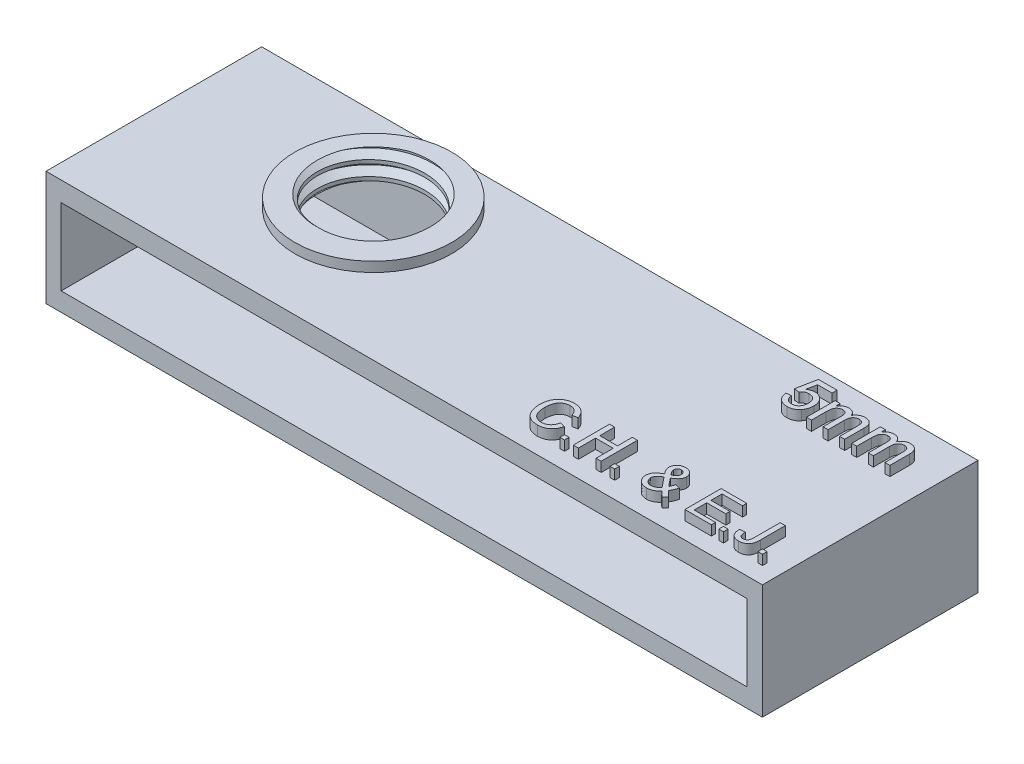
from build123d import *

# Parameters (mm, degrees)
SKIZZE1_W                       = 73.1
SKIZZE1_H                       = 22
BASIS_DEPTH                     = 11.7
SKIZZE2_W                       = 70
SKIZZE2_H                       = 7.8
HANDYSCHLITZ_DEPTH              = 21.25
SKIZZE3_R                       = 6.3
ZYLINDER_DEPTH                  = 1
SKIZZE6_R                       = 8
AUFSATZ_LINEAR_AUSTRAGEN1_DEPTH = 1
SKIZZE8_R                       = 6.3
SCHNITT_LINEAR_AUSTRAGEN2_DEPTH = 6
GEWINDE2_PITCH                  = 1.5
SKIZZE12_R                      = 7.5
SCHNITT_LINEAR_AUSTRAGEN5_DEPTH = 6
SKIZZE17_W                      = 30.300932881
SKIZZE17_H                      = 16.269400137
SCHNITT_LINEAR_AUSTRAGEN7_DEPTH = 6
EAH_JENA_DEPTH                  = 1
LOGO_DEPTH                      = 1
SKIZZE26_W                      = 0.474358974
SKIZZE26_H                      = 0.474358974
SKIZZE26_W_2                    = 0.474358975
C_H_E_J_DEPTH                   = 1
F_5MM_DEPTH                     = 1


with BuildPart() as part:
    # Skizze1 → Basis (new body)
    with BuildSketch(Plane(origin=(0, 0, 0), x_dir=(1, 0, 0), z_dir=(0, 1, 0))):
        with Locations((-9.866464149, 7.203333333)):
            Rectangle(SKIZZE1_W, SKIZZE1_H)
    extrude(amount=BASIS_DEPTH)

    # Skizze2 → Handyschlitz (cut)
    with BuildSketch(Plane.XY.offset(3.796666667)):
        with Locations((-9.866464149, 5.8)):
            Rectangle(SKIZZE2_W, SKIZZE2_H)
    extrude(amount=-HANDYSCHLITZ_DEPTH, mode=Mode.SUBTRACT)

    # Skizze3 → Zylinder (add)
    with BuildSketch(Plane(origin=(0, 11.7, 0), x_dir=(1, 0, 0), z_dir=(0, 1, 0))):
        with Locations(Location((-26.416464149, 9.603333333, 0), (0, 0, 270))):
            Circle(SKIZZE3_R)
    extrude(amount=ZYLINDER_DEPTH)

    # Skizze6 → Aufsatz-Linear austragen1 (add)
    with BuildSketch(Plane(origin=(0, 11.7, 0), x_dir=(1, 0, 0), z_dir=(0, 1, 0))):
        with Locations(Location((-26.416464149, 9.603333333, 0), (0, 0, 270))):
            Circle(SKIZZE6_R)
    extrude(amount=AUFSATZ_LINEAR_AUSTRAGEN1_DEPTH)

    # Skizze8 → Schnitt-Linear austragen2 (cut)
    with BuildSketch(Plane(origin=(0, 12.7, 0), x_dir=(1, 0, 0), z_dir=(0, 1, 0))):
        with Locations(Location((-26.416464149, 9.603333333, 0), (0, 0, 270))):
            Circle(SKIZZE8_R)
    extrude(amount=-SCHNITT_LINEAR_AUSTRAGEN2_DEPTH, mode=Mode.SUBTRACT)

    # Gewinde2: the profile of Gewindeprofil2 profile screwed along a right-hand helix of 5.333333 turns, 8 arcs to a turn; built about Z, then put on its axis
    gewinde2_z = Axis((0, 0, 0), (0, 0, 1))
    gewinde2_corners = [(6.3003, 0, -0.000173205), (6.3003, 0, 1.312673201), (5.488101187, 0, 0.843749998), (5.488101187, 0, 0.468749998)]
    with BuildLine(mode=Mode.PRIVATE) as gewinde2_profile:
        Line(gewinde2_corners[0], gewinde2_corners[1])
        Line(gewinde2_corners[1], gewinde2_corners[2])
        Line(gewinde2_corners[2], gewinde2_corners[3])
        Line(gewinde2_corners[3], gewinde2_corners[0])
    gewinde2_cap = Face(gewinde2_profile.wire())
    gewinde2_turn_angles = [0, 22.5, 45, 67.5, 90, 112.5, 135, 157.5, 180, 202.5, 225, 247.5, 270, 292.5, 315, 337.5, 360]
    gewinde2_turn_weights = [1, 0.9238795325112867, 1, 0.9238795325112867, 1, 0.9238795325112867, 1, 0.9238795325112867, 1, 0.9238795325112867, 1, 0.9238795325112867, 1, 0.9238795325112867, 1, 0.9238795325112867, 1]
    gewinde2_turn_rails = [Edge.make_bspline([Vector(p[0], p[1], 0).rotate(gewinde2_z, gewinde2_turn_angles[k]) / gewinde2_turn_weights[k] + Vector(0, 0, p[2] + GEWINDE2_PITCH * gewinde2_turn_angles[k] / 360) for k in range(17)], [0, 0, 0, 1, 1, 2, 2, 3, 3, 4, 4, 5, 5, 6, 6, 7, 7, 8, 8, 8], 2, gewinde2_turn_weights) for p in gewinde2_corners]
    gewinde2_turn_sides = [Face.make_surface_from_curves(gewinde2_turn_rails[p[0]], gewinde2_turn_rails[p[1]]) for p in [(0, 1), (1, 2), (2, 3), (3, 0)]]
    gewinde2_last_angles = [1800, 1822.5, 1845, 1867.5, 1890, 1905, 1920]
    gewinde2_last_weights = [1, 0.9238795325112867, 1, 0.9238795325112867, 1, 0.9659258262890688, 1]
    gewinde2_last_rails = [Edge.make_bspline([Vector(p[0], p[1], 0).rotate(gewinde2_z, gewinde2_last_angles[k]) / gewinde2_last_weights[k] + Vector(0, 0, p[2] + GEWINDE2_PITCH * gewinde2_last_angles[k] / 360) for k in range(7)], [0, 0, 0, 1, 1, 2, 2, 3, 3, 3], 2, gewinde2_last_weights) for p in gewinde2_corners]
    gewinde2_last_sides = [Face.make_surface_from_curves(gewinde2_last_rails[p[0]], gewinde2_last_rails[p[1]]) for p in [(0, 1), (1, 2), (2, 3), (3, 0)]]
    gewinde2 = Plane(origin=(-26.416464149, 14.3, -9.603333333), x_dir=(-1, 0, 0), z_dir=(0, -1, 0)) * Solid(Shell([*[p.moved(Location((0, 0, GEWINDE2_PITCH * i))) for i in range(5) for p in gewinde2_turn_sides], *gewinde2_last_sides, gewinde2_cap, gewinde2_cap.rotate(gewinde2_z, 1920).moved(Location((0, 0, GEWINDE2_PITCH * 1920 / 360)))]))
    add(gewinde2)

    # Skizze12 → Schnitt-Linear austragen5 (cut)
    with BuildSketch(Plane(origin=(0, 12.7, 0), x_dir=(1, 0, 0), z_dir=(0, 1, 0))):
        with Locations((-26.416464149, 9.603333333)):
            Circle(SKIZZE12_R)
    extrude(amount=SCHNITT_LINEAR_AUSTRAGEN5_DEPTH, mode=Mode.SUBTRACT)

    # Skizze17 → Schnitt-Linear austragen7 (cut)
    with BuildSketch(Plane(origin=(0, 9.7, 0), x_dir=(-1, 0, 0), z_dir=(0, -1, 0))):
        with Locations((28.531838804, 8.134700069)):
            Rectangle(SKIZZE17_W, SKIZZE17_H)
    extrude(amount=SCHNITT_LINEAR_AUSTRAGEN7_DEPTH, mode=Mode.SUBTRACT)

    # Skizze25 → EAH Jena (add)
    # profile 1 of 7: a face of its own
    with BuildSketch(Plane(origin=(0, 0, 0), x_dir=(-1, 0, 0), z_dir=(0, -1, 0))):
        Polygon((6.791710178, -1.663041856), (6.791710178, 1.836958144), (9.259658895, 1.836958144), (9.259658895, 1.43311199), (7.285299921, 1.43311199), (7.285299921, 0.356188913), (9.125043511, 0.356188913), (9.125043511, -0.047657241), (7.285299921, -0.047657241), (7.285299921, -1.259195702), (9.349402485, -1.259195702), (9.349402485, -1.663041856), align=None)
    # profile 2 of 7: a face of its own
    with BuildSketch(Plane(origin=(0, 0, 0), x_dir=(-1, 0, 0), z_dir=(0, -1, 0))):
        Polygon((9.543613222, -1.663041856), (10.93323662, 1.836958144), (11.489927325, 1.836958144), (12.879550722, -1.663041856), (12.355812742, -1.663041856), (11.957575562, -0.586118779), (10.465588383, -0.586118779), (10.067351203, -1.663041856), align=None)
        with BuildLine():
            Line((10.614226203, -0.182272625), (11.808937742, -0.182272625))
            Line((11.808937742, -0.182272625), (11.468893671, 0.737599169))
            add(Edge.make_bspline(
                [(11.468893671, 0.737599169), (11.455857596, 0.773141762), (11.430369606, 0.842634241), (11.392359336, 0.943600948), (11.357633765, 1.039483076), (11.323582491, 1.128905814), (11.292843798, 1.213168117), (11.264511156, 1.291700831), (11.236490413, 1.363958117), (11.219674771, 1.410643768), (11.211581972, 1.43311199)],
                knots=[0, 0, 0, 0, 1.225184869, 2.395467751, 3.491410812, 4.525364584, 5.492066482, 6.394148129, 7.227157926, 8, 8, 8, 8], degree=3))
            add(Edge.make_bspline(
                [(11.211581972, 1.43311199), (11.198194921, 1.377707334), (11.171365621, 1.266669571), (11.115191597, 1.103984353), (11.050930465, 0.942786964), (10.998742768, 0.838912467), (10.97249944, 0.786677695)],
                knots=[0, 0, 0, 0, 0.9891762, 1.982431084, 2.985436691, 4, 4, 4, 4], degree=3))
            Line((10.97249944, 0.786677695), (10.614226203, -0.182272625))
        make_face(mode=Mode.SUBTRACT)
    # profile 3 of 7: a face of its own
    with BuildSketch(Plane(origin=(0, 0, 0), x_dir=(-1, 0, 0), z_dir=(0, -1, 0))):
        Polygon((13.253248639, -1.663041856), (13.253248639, 1.836958144), (13.746838383, 1.836958144), (13.746838383, 0.401060708), (15.451966588, 0.401060708), (15.451966588, 1.836958144), (15.945556331, 1.836958144), (15.945556331, -1.663041856), (15.451966588, -1.663041856), (15.451966588, -0.002785446), (13.746838383, -0.002785446), (13.746838383, -1.663041856), align=None)
    # profile 4 of 7: a face of its own
    with BuildSketch(Plane(origin=(0, 0, 0), x_dir=(-1, 0, 0), z_dir=(0, -1, 0))):
        with BuildLine():
            Line((17.830171716, -0.686379196), (18.32376146, -0.630990574))
            add(Edge.make_bspline(
                [(18.32376146, -0.630990574), (18.325095054, -0.662092888), (18.327646186, -0.721590801), (18.336104163, -0.807008212), (18.347911279, -0.884697448), (18.36253253, -0.954942231), (18.379565969, -1.017791317), (18.400937234, -1.072737648), (18.423953924, -1.120935667), (18.452253265, -1.16088606), (18.482595025, -1.195029748), (18.515973611, -1.224020964), (18.55195843, -1.248725405), (18.590477759, -1.269133188), (18.631964985, -1.28478687), (18.67598885, -1.295660465), (18.722912253, -1.30318799), (18.755153505, -1.303768279), (18.771778286, -1.304067497)],
                knots=[0, 0, 0, 0, 1.632619403, 3.123158228, 4.499702462, 5.75227728, 6.885496867, 7.90993266, 8.841891104, 9.678429245, 10.468404694, 11.232957398, 11.991194639, 12.753385178, 13.513799276, 14.310593147, 15.128879333, 16, 16, 16, 16], degree=3))
            add(Edge.make_bspline(
                [(18.771778286, -1.304067497), (18.795948594, -1.303258637), (18.843177355, -1.301678124), (18.910921454, -1.28543416), (18.974042611, -1.261062533), (19.030755547, -1.22547634), (19.081319043, -1.182174894), (19.124329594, -1.131076481), (19.157092165, -1.072023015), (19.177726711, -1.017500544), (19.190384105, -0.968972917), (19.198667701, -0.926815945), (19.205651202, -0.879785295), (19.210925971, -0.827586205), (19.216281114, -0.770370123), (19.218420462, -0.70788694), (19.220914052, -0.64059173), (19.221100747, -0.594067985), (19.221197357, -0.569992978)],
                knots=[0, 0, 0, 0, 1.177507829, 2.300849353, 3.381033894, 4.466744326, 5.550475886, 6.619462111, 7.707386998, 8.830091395, 9.455333453, 10.153234525, 10.925888378, 11.774835866, 12.713513529, 13.729654905, 14.82514671, 16, 16, 16, 16], degree=3))
            Line((19.221197357, -0.569992978), (19.221197357, 1.836958144))
            Line((19.221197357, 1.836958144), (19.714787101, 1.836958144))
            Line((19.714787101, 1.836958144), (19.714787101, -0.538442497))
            add(Edge.make_bspline(
                [(19.714787101, -0.538442497), (19.714585465, -0.573971391), (19.714195247, -0.64272918), (19.709274699, -0.742842863), (19.70071679, -0.83682133), (19.689966548, -0.924870761), (19.675220284, -1.006805068), (19.656977905, -1.082350925), (19.636304717, -1.152121748), (19.603857092, -1.235394111), (19.554453955, -1.329868022), (19.478858362, -1.430064774), (19.387489561, -1.515539903), (19.281383393, -1.585889093), (19.163086158, -1.640180619), (19.034637285, -1.679598823), (18.896333766, -1.703992263), (18.800627436, -1.706582551), (18.751445754, -1.707913651)],
                knots=[0, 0, 0, 0, 0.979376435, 1.895351937, 2.762129694, 3.580429744, 4.339931879, 5.055623694, 5.722093767, 6.344240595, 7.517202841, 8.648554164, 9.788057829, 10.949533591, 12.142879013, 13.363546981, 14.645176409, 16, 16, 16, 16], degree=3))
            add(Edge.make_bspline(
                [(18.751445754, -1.707913651), (18.714948055, -1.707116316), (18.643854654, -1.705563197), (18.540496883, -1.693216986), (18.443373338, -1.674648981), (18.353691663, -1.644782191), (18.269632392, -1.609837507), (18.192822629, -1.564925889), (18.121947614, -1.513107367), (18.058801793, -1.452160372), (18.0018615, -1.384064763), (17.954778148, -1.306698621), (17.913168703, -1.222861112), (17.88175556, -1.130217094), (17.855988431, -1.03048475), (17.840050493, -0.922391611), (17.82958188, -0.80694885), (17.829971513, -0.727303214), (17.830171716, -0.686379196)],
                knots=[0, 0, 0, 0, 1.110149412, 2.162445788, 3.163771351, 4.112774839, 5.033433762, 5.928696445, 6.813333667, 7.698542325, 8.592646346, 9.506220098, 10.44759987, 11.434914499, 12.476633792, 13.577933972, 14.755478919, 16, 16, 16, 16], degree=3))
        make_face()
    # profile 5 of 7: a face of its own
    with BuildSketch(Plane(origin=(0, 0, 0), x_dir=(-1, 0, 0), z_dir=(0, -1, 0))):
        Polygon((20.522479408, -1.663041856), (20.522479408, 1.836958144), (22.990428126, 1.836958144), (22.990428126, 1.43311199), (21.016069152, 1.43311199), (21.016069152, 0.356188913), (22.855812742, 0.356188913), (22.855812742, -0.047657241), (21.016069152, -0.047657241), (21.016069152, -1.259195702), (23.080171716, -1.259195702), (23.080171716, -1.663041856), align=None)
    # profile 6 of 7: a face of its own
    with BuildSketch(Plane(origin=(0, 0, 0), x_dir=(-1, 0, 0), z_dir=(0, -1, 0))):
        Polygon((23.753248639, -1.663041856), (23.753248639, 1.836958144), (24.274883254, 1.836958144), (25.951966588, -0.774720542), (25.951966588, 1.836958144), (26.445556331, 1.836958144), (26.445556331, -1.663041856), (25.923921716, -1.663041856), (24.246838383, 0.94863683), (24.246838383, -1.663041856), align=None)
    # profile 7 of 7: a face of its own
    with BuildSketch(Plane(origin=(0, 0, 0), x_dir=(-1, 0, 0), z_dir=(0, -1, 0))):
        Polygon((26.774382453, -1.663041856), (28.164005851, 1.836958144), (28.720696556, 1.836958144), (30.110319953, -1.663041856), (29.586581972, -1.663041856), (29.188344793, -0.586118779), (27.696357613, -0.586118779), (27.298120434, -1.663041856), align=None)
        with BuildLine():
            Line((27.844995434, -0.182272625), (29.039706972, -0.182272625))
            Line((29.039706972, -0.182272625), (28.699662902, 0.737599169))
            add(Edge.make_bspline(
                [(28.699662902, 0.737599169), (28.686626826, 0.773141762), (28.661138837, 0.842634241), (28.623128566, 0.943600948), (28.588402995, 1.039483076), (28.554351722, 1.128905814), (28.523613028, 1.213168117), (28.495280387, 1.291700831), (28.467259644, 1.363958117), (28.450444002, 1.410643768), (28.442351203, 1.43311199)],
                knots=[0, 0, 0, 0, 1.225184869, 2.395467751, 3.491410812, 4.525364584, 5.492066482, 6.394148129, 7.227157926, 8, 8, 8, 8], degree=3))
            add(Edge.make_bspline(
                [(28.442351203, 1.43311199), (28.428964152, 1.377707334), (28.402134851, 1.266669571), (28.345960828, 1.103984353), (28.281699695, 0.942786964), (28.229511999, 0.838912467), (28.203268671, 0.786677695)],
                knots=[0, 0, 0, 0, 0.9891762, 1.982431084, 2.985436691, 4, 4, 4, 4], degree=3))
            Line((28.203268671, 0.786677695), (27.844995434, -0.182272625))
        make_face(mode=Mode.SUBTRACT)
    extrude(amount=EAH_JENA_DEPTH)

    # Skizze24 → LOGO (add)
    with BuildSketch(Plane(origin=(0, 0, 0), x_dir=(-1, 0, 0), z_dir=(0, -1, 0))):
        Polygon((33.761487263, 1.43405578), (32.029436456, -1.56594422), (35.493538071, -1.56594422), align=None)
        Polygon((35.947767039, -1.538115831), (37.679817846, 1.461884169), (34.215716231, 1.461884169), align=None)
        Polygon((38.093112145, 1.43405578), (36.361061337, -1.56594422), (39.825162952, -1.56594422), align=None)
        Polygon((40.238164925, -1.538115831), (41.970215732, 1.461884169), (38.506114117, 1.461884169), align=None)
        Polygon((42.342197995, 1.43405578), (40.610147188, -1.56594422), (44.074248803, -1.56594422), align=None)
        Polygon((35.947458768, 4.854602398), (34.21540796, 1.854602398), (37.679509575, 1.854602398), align=None)
        Polygon((38.133781063, 1.93405578), (39.865831871, 4.93405578), (36.401730256, 4.93405578), align=None)
        Polygon((40.279078334, 4.854602398), (38.547027526, 1.854602398), (42.011129142, 1.854602398), align=None)
        Polygon((38.133781063, 8.331557422), (36.401730256, 5.331557422), (39.865831871, 5.331557422), align=None)
    extrude(amount=LOGO_DEPTH)

    # Skizze26 → C.H. & E.J. (add)
    # profile 1 of 9: a face of its own
    with BuildSketch(Plane(origin=(0, 11.7, 0), x_dir=(1, 0, 0), z_dir=(0, 1, 0))):
        with BuildLine():
            Line((3.075711078, -0.786637436), (3.59750595, -0.908191923))
            add(Edge.make_bspline(
                [(3.59750595, -0.908191923), (3.584433532, -0.957098307), (3.55886226, -1.052765264), (3.508304748, -1.189675268), (3.451560142, -1.318159468), (3.38725156, -1.437879412), (3.31467515, -1.548146786), (3.235753894, -1.650378737), (3.147361833, -1.742431365), (3.052742176, -1.826429196), (2.951158207, -1.90051506), (2.843834679, -1.964489562), (2.731290373, -2.018918877), (2.613070418, -2.063678204), (2.489098172, -2.097363435), (2.36001197, -2.121915204), (2.225435405, -2.137037665), (2.133703404, -2.139028581), (2.086969091, -2.140042885)],
                knots=[0, 0, 0, 0, 1.145254194, 2.240259345, 3.299159039, 4.322497661, 5.312016644, 6.284080175, 7.241264552, 8.196044782, 9.144516039, 10.082428046, 11.020306713, 11.970622414, 12.939253955, 13.924100776, 14.94240044, 16, 16, 16, 16], degree=3))
            add(Edge.make_bspline(
                [(2.086969091, -2.140042885), (2.039018781, -2.139346253), (1.94520783, -2.137983348), (1.807780197, -2.126897844), (1.677073022, -2.107671761), (1.553330399, -2.080959872), (1.436135826, -2.04793228), (1.325975275, -2.006380644), (1.223041698, -1.956604773), (1.126476491, -1.899996744), (1.036689799, -1.835687473), (0.951639842, -1.765412494), (0.87339135, -1.687237213), (0.799987815, -1.603007422), (0.733027992, -1.511612013), (0.670048416, -1.41429263), (0.614123082, -1.309334511), (0.563179441, -1.198683581), (0.518465118, -1.083411141), (0.478908583, -0.965794139), (0.446568953, -0.84559821), (0.418726619, -0.723834783), (0.398500512, -0.599479303), (0.382441609, -0.473464815), (0.373612101, -0.345018742), (0.372450231, -0.25867823), (0.371864925, -0.215183109)],
                knots=[0, 0, 0, 0, 1.180702053, 2.309949215, 3.392367133, 4.431746864, 5.425408375, 6.388154007, 7.326956194, 8.237882283, 9.141054626, 10.043899035, 10.951650021, 11.86168169, 12.792564695, 13.739356664, 14.713891418, 15.718426911, 16.737522708, 17.757217648, 18.772674716, 19.801476837, 20.831699174, 21.873853055, 22.928926693, 24, 24, 24, 24], degree=3))
            add(Edge.make_bspline(
                [(0.371864925, -0.215183109), (0.372702036, -0.168228372), (0.374355958, -0.075457672), (0.383692318, 0.06142819), (0.400839828, 0.193539792), (0.424652732, 0.320964035), (0.454785582, 0.443804115), (0.491981207, 0.562119878), (0.535769084, 0.67575994), (0.58601572, 0.784849613), (0.643054943, 0.888171168), (0.705184366, 0.985871486), (0.773886016, 1.076346369), (0.847122989, 1.161324367), (0.926724428, 1.239390499), (1.012447266, 1.310721605), (1.103551922, 1.375968313), (1.200025099, 1.4345249), (1.30060578, 1.485905242), (1.403800018, 1.53167016), (1.51001826, 1.569180732), (1.618418379, 1.600369264), (1.729233749, 1.625198232), (1.842723303, 1.641801441), (1.958782175, 1.652621379), (2.03703813, 1.65408774), (2.076592489, 1.65482891)],
                knots=[0, 0, 0, 0, 1.185634383, 2.342514083, 3.462112933, 4.547331452, 5.613960142, 6.653690668, 7.676612054, 8.686959706, 9.683658101, 10.654407272, 11.607580201, 12.5494388, 13.484601218, 14.419076806, 15.362504069, 16.311442244, 17.265594461, 18.212500624, 19.159571152, 20.107257795, 21.059246075, 22.024387127, 23.001429356, 24, 24, 24, 24], degree=3))
            add(Edge.make_bspline(
                [(2.076592489, 1.65482891), (2.120848487, 1.653994707), (2.207838034, 1.652354997), (2.335479696, 1.638868059), (2.457727082, 1.616278916), (2.575109911, 1.586644097), (2.686407776, 1.54606786), (2.792829008, 1.497827378), (2.893314927, 1.439872282), (2.988647398, 1.373795284), (3.077274555, 1.299474522), (3.160436641, 1.218685498), (3.234742743, 1.129409076), (3.303135834, 1.033805905), (3.36346404, 0.930550295), (3.417946775, 0.820542524), (3.464800341, 0.70296481), (3.489869332, 0.62106868), (3.502634155, 0.579368173)],
                knots=[0, 0, 0, 0, 1.098391872, 2.158997981, 3.181470371, 4.182549255, 5.160268219, 6.118029851, 7.079534476, 8.035645336, 8.993622929, 9.94770573, 10.909620999, 11.872786677, 12.862530088, 13.874594564, 14.917769567, 16, 16, 16, 16], degree=3))
            Line((3.502634155, 0.579368173), (2.980839284, 0.467449103))
            add(Edge.make_bspline(
                [(2.980839284, 0.467449103), (2.970592047, 0.499452101), (2.950535034, 0.56209187), (2.914921845, 0.651364674), (2.876460789, 0.734239002), (2.834235691, 0.810151514), (2.78815504, 0.879120391), (2.739279953, 0.941983849), (2.68643943, 0.997568531), (2.630708291, 1.047156082), (2.570647397, 1.08939993), (2.507664833, 1.126834931), (2.440432615, 1.157806686), (2.369917927, 1.184002392), (2.295461675, 1.203940147), (2.217367056, 1.217967145), (2.135565453, 1.226085283), (2.079822255, 1.22729093), (2.051392168, 1.227905833)],
                knots=[0, 0, 0, 0, 1.235697765, 2.418642872, 3.532555292, 4.594392283, 5.610119701, 6.580908344, 7.519430642, 8.427315627, 9.319973334, 10.216139639, 11.118687699, 12.038725643, 12.980015607, 13.949697744, 14.954307006, 16, 16, 16, 16], degree=3))
            add(Edge.make_bspline(
                [(2.051392168, 1.227905833), (2.018751827, 1.227432254), (1.95455791, 1.226500864), (1.860249322, 1.216306904), (1.769680276, 1.201292196), (1.68352578, 1.17877635), (1.601314389, 1.150704945), (1.523533962, 1.115751079), (1.449522862, 1.074781048), (1.380107091, 1.027548822), (1.315870027, 0.97445071), (1.255068461, 0.918317697), (1.200621543, 0.856531869), (1.150453049, 0.791130549), (1.106023883, 0.720958047), (1.066030191, 0.646970199), (1.030726903, 0.568560616), (0.992243921, 0.458205066), (0.953005363, 0.316069671), (0.918965866, 0.142142015), (0.897283509, -0.034525858), (0.894870255, -0.15335589), (0.893659796, -0.212959551)],
                knots=[0, 0, 0, 0, 0.935256702, 1.839373932, 2.716087708, 3.564631604, 4.388828665, 5.203538865, 6.005592122, 6.810952829, 7.606223804, 8.392839071, 9.180346482, 9.963639178, 10.753404291, 11.558266631, 12.372976832, 13.215232055, 14.905983541, 16.594894834, 18.292041732, 20, 20, 20, 20], degree=3))
            add(Edge.make_bspline(
                [(0.893659796, -0.212959551), (0.895025022, -0.287901181), (0.897673682, -0.433294729), (0.923809451, -0.643993995), (0.963657015, -0.840519697), (1.011747284, -0.993848902), (1.059986656, -1.106947411), (1.099000236, -1.186151928), (1.143532681, -1.259443945), (1.192476307, -1.327239697), (1.246461559, -1.389341426), (1.304736313, -1.44607902), (1.367313587, -1.497998429), (1.434934863, -1.542669211), (1.504997313, -1.58233297), (1.576616805, -1.617602742), (1.649838432, -1.647432354), (1.724957612, -1.670604603), (1.800919471, -1.690628647), (1.87856065, -1.703709293), (1.95785901, -1.711091597), (2.011105897, -1.712438317), (2.038050822, -1.713119808)],
                knots=[0, 0, 0, 0, 2.10686522, 4.087509323, 5.961373225, 7.741398778, 8.594514555, 9.418024779, 10.222433421, 11.003575649, 11.767087398, 12.533660211, 13.289033706, 14.050297079, 14.809623433, 15.552362432, 16.294320901, 17.0305302, 17.761969017, 18.502233515, 19.242073914, 20, 20, 20, 20], degree=3))
            add(Edge.make_bspline(
                [(2.038050822, -1.713119808), (2.0702059, -1.712445448), (2.133723549, -1.711113349), (2.226848488, -1.699453415), (2.316619645, -1.682270975), (2.401949456, -1.655756737), (2.483985702, -1.623293158), (2.562056238, -1.583259887), (2.635915543, -1.535111548), (2.706432365, -1.480443631), (2.772306313, -1.418240883), (2.832676244, -1.34900444), (2.886834893, -1.272418663), (2.93705359, -1.189712643), (2.979246525, -1.098415644), (3.018327145, -1.001248829), (3.050891941, -0.896615174), (3.067319189, -0.823823297), (3.075711078, -0.786637436)],
                knots=[0, 0, 0, 0, 1.013374089, 2.001772144, 2.95501459, 3.891367103, 4.814208647, 5.733921849, 6.652182523, 7.590185968, 8.54346024, 9.504121027, 10.481158517, 11.497760682, 12.549996529, 13.647863555, 14.798406869, 16, 16, 16, 16], degree=3))
        make_face()
    # profile 2 of 9: a face of its own
    with BuildSketch(Plane(origin=(0, 11.7, 0), x_dir=(1, 0, 0), z_dir=(0, 1, 0))):
        with Locations((4.546223899, -1.8554275)):
            Rectangle(SKIZZE26_W, SKIZZE26_H)
    # profile 3 of 9: a face of its own
    with BuildSketch(Plane(origin=(0, 11.7, 0), x_dir=(1, 0, 0), z_dir=(0, 1, 0))):
        Polygon((5.684685437, -2.092606987), (5.684685437, 1.607393013), (6.206480309, 1.607393013), (6.206480309, 0.089444295), (8.009044412, 0.089444295), (8.009044412, 1.607393013), (8.530839284, 1.607393013), (8.530839284, -2.092606987), (8.009044412, -2.092606987), (8.009044412, -0.337478782), (6.206480309, -0.337478782), (6.206480309, -2.092606987), align=None)
    # profile 4 of 9: a face of its own
    with BuildSketch(Plane(origin=(0, 11.7, 0), x_dir=(1, 0, 0), z_dir=(0, 1, 0))):
        with Locations((9.669300822, -1.8554275)):
            Rectangle(SKIZZE26_W, SKIZZE26_H)
    # profile 5 of 9: a face of its own
    with BuildSketch(Plane(origin=(0, 11.7, 0), x_dir=(1, 0, 0), z_dir=(0, 1, 0))):
        with BuildLine():
            add(Edge.make_bspline(
                [(14.274288803, -1.623436314), (14.236749524, -1.664462929), (14.163257436, -1.744782311), (14.042552731, -1.849998573), (13.917470321, -1.940290358), (13.786477409, -2.013029645), (13.65060685, -2.070196079), (13.509204053, -2.110053588), (13.362562531, -2.135543554), (13.262675527, -2.138531887), (13.212169412, -2.140042885)],
                knots=[0, 0, 0, 0, 1.093164284, 2.140129739, 3.143504165, 4.122525029, 5.081066102, 6.036361366, 7.007120508, 8, 8, 8, 8], degree=3))
            add(Edge.make_bspline(
                [(13.212169412, -2.140042885), (13.165909178, -2.138970887), (13.075747117, -2.136881543), (12.944142423, -2.118648824), (12.820070528, -2.088999846), (12.70258584, -2.048568671), (12.593263009, -1.994563428), (12.490632385, -1.929585812), (12.395281166, -1.852701131), (12.339129135, -1.792870963), (12.31088736, -1.762779263)],
                knots=[0, 0, 0, 0, 1.100470892, 2.144838377, 3.154486211, 4.132569556, 5.094958372, 6.049140531, 7.018811397, 8, 8, 8, 8], degree=3))
            add(Edge.make_bspline(
                [(12.31088736, -1.762779263), (12.289477049, -1.736907866), (12.247436665, -1.68610788), (12.19217435, -1.605403866), (12.145441194, -1.522609076), (12.107263764, -1.437246516), (12.077347802, -1.349730381), (12.056934742, -1.259754654), (12.043696914, -1.167750925), (12.041969577, -1.105640225), (12.041095694, -1.074217564)],
                knots=[0, 0, 0, 0, 1.065358646, 2.091893341, 3.099477229, 4.078716359, 5.055661193, 6.029485947, 7.003089712, 8, 8, 8, 8], degree=3))
            add(Edge.make_bspline(
                [(12.041095694, -1.074217564), (12.041925717, -1.046278276), (12.043561268, -0.991224234), (12.053039085, -0.909506261), (12.07071677, -0.830168624), (12.092965327, -0.752154885), (12.124100415, -0.676802044), (12.161200875, -0.603572428), (12.204195592, -0.531781021), (12.254957897, -0.462915758), (12.312438384, -0.396036572), (12.376168238, -0.330767612), (12.446806803, -0.26770639), (12.524049835, -0.207201318), (12.607357031, -0.148071855), (12.698043309, -0.092480772), (12.794426087, -0.036824502), (12.862373102, -0.003315148), (12.897165405, 0.013843333)],
                knots=[0, 0, 0, 0, 0.915018781, 1.803033897, 2.688392046, 3.574045808, 4.455848883, 5.353064954, 6.260398892, 7.19238917, 8.150553927, 9.145935903, 10.177161104, 11.248536403, 12.357283344, 13.520048458, 14.730139544, 16, 16, 16, 16], degree=3))
            add(Edge.make_bspline(
                [(12.897165405, 0.013843333), (12.878828843, 0.037271881), (12.843315936, 0.082646573), (12.792629914, 0.149226601), (12.747503283, 0.212832413), (12.707374794, 0.273398358), (12.670994297, 0.329902724), (12.639763392, 0.383277246), (12.613557189, 0.433251983), (12.58532489, 0.494556618), (12.557426586, 0.568639844), (12.533967855, 0.656315804), (12.517678602, 0.742319799), (12.516190461, 0.799428661), (12.515454668, 0.827665449)],
                knots=[0, 0, 0, 0, 1.168292938, 2.262664013, 3.285595573, 4.230065678, 5.115538581, 5.924229713, 6.657599296, 7.330460229, 8.573844772, 9.760007627, 10.892462829, 12, 12, 12, 12], degree=3))
            add(Edge.make_bspline(
                [(12.515454668, 0.827665449), (12.515999697, 0.855148108), (12.517076164, 0.909428167), (12.530712954, 0.989259715), (12.550116851, 1.066467721), (12.578821457, 1.140704442), (12.615600906, 1.211880344), (12.658904777, 1.281467523), (12.712651576, 1.346424898), (12.771869745, 1.409413939), (12.838159123, 1.466432021), (12.908675732, 1.517531698), (12.984223945, 1.559786868), (13.063554666, 1.594834184), (13.147360006, 1.621544052), (13.235198652, 1.640653924), (13.327198169, 1.652983169), (13.390014149, 1.654207131), (13.421925021, 1.65482891)],
                knots=[0, 0, 0, 0, 0.964773243, 1.905490621, 2.838442154, 3.759192401, 4.695048573, 5.651344959, 6.633121115, 7.65260708, 8.686704549, 9.701112235, 10.708097826, 11.722839901, 12.744320586, 13.793472898, 14.87907178, 16, 16, 16, 16], degree=3))
            add(Edge.make_bspline(
                [(13.421925021, 1.65482891), (13.452355984, 1.654180163), (13.511946312, 1.652909777), (13.599133261, 1.64108179), (13.682581898, 1.624097802), (13.761224985, 1.597498135), (13.836243251, 1.56529829), (13.905924122, 1.52369866), (13.972409268, 1.476436572), (14.03342516, 1.421655335), (14.088456747, 1.362106756), (14.137285921, 1.299254837), (14.179036211, 1.233484942), (14.212473088, 1.163966775), (14.238468897, 1.091913167), (14.257169079, 1.016946238), (14.268516647, 0.938945277), (14.269887656, 0.885763085), (14.270582873, 0.858795256)],
                knots=[0, 0, 0, 0, 1.123791971, 2.200624789, 3.246281673, 4.265339271, 5.262698678, 6.256919688, 7.25765751, 8.27278209, 9.280532237, 10.250139998, 11.210073034, 12.153234139, 13.094626374, 14.035620154, 15.003894765, 16, 16, 16, 16], degree=3))
            add(Edge.make_bspline(
                [(14.270582873, 0.858795256), (14.269935309, 0.836788964), (14.268650337, 0.793121503), (14.260689256, 0.727958982), (14.24531569, 0.664757115), (14.226239554, 0.601961551), (14.200181378, 0.541124204), (14.168740895, 0.48112177), (14.131407585, 0.422493092), (14.088717368, 0.364872489), (14.039577462, 0.308960936), (13.986112383, 0.25324645), (13.925329983, 0.200265421), (13.860265405, 0.147225907), (13.788649354, 0.096263673), (13.711789133, 0.046021213), (13.629337767, -0.003218383), (13.571546534, -0.03361519), (13.541997136, -0.049157468)],
                knots=[0, 0, 0, 0, 0.861148472, 1.70879154, 2.562256628, 3.402982304, 4.273679903, 5.147056083, 6.050768824, 6.990318587, 7.949648442, 8.961312249, 10.008866095, 11.101815886, 12.244580615, 13.445664923, 14.693935717, 16, 16, 16, 16], degree=3))
            Line((13.541997136, -0.049157468), (14.209064444, -0.880026859))
            add(Edge.make_bspline(
                [(14.209064444, -0.880026859), (14.230571539, -0.84235794), (14.274424164, -0.765551615), (14.327092613, -0.640906926), (14.375544007, -0.508850469), (14.400263385, -0.416516116), (14.412890566, -0.369349776)],
                knots=[0, 0, 0, 0, 0.942661657, 1.922072078, 2.938550464, 4, 4, 4, 4], degree=3))
            Line((14.412890566, -0.369349776), (14.88724954, -0.469409872))
            add(Edge.make_bspline(
                [(14.88724954, -0.469409872), (14.877098835, -0.508259612), (14.857166937, -0.584544863), (14.823943065, -0.695924622), (14.787482461, -0.801602304), (14.749546523, -0.90222729), (14.706541498, -0.996056931), (14.663405396, -1.085377158), (14.616649183, -1.168820528), (14.582421651, -1.2211549), (14.56557486, -1.246913878)],
                knots=[0, 0, 0, 0, 1.139557996, 2.237633175, 3.297547274, 4.31192991, 5.288002333, 6.225615005, 7.126647716, 8, 8, 8, 8], degree=3))
            add(Edge.make_bspline(
                [(14.56557486, -1.246913878), (14.607251166, -1.299744242), (14.689645978, -1.404190831), (14.826294256, -1.547144108), (14.970017721, -1.678144449), (15.073120205, -1.754947128), (15.124429027, -1.793167885)],
                knots=[0, 0, 0, 0, 1.028924747, 2.034202902, 3.021723538, 4, 4, 4, 4], degree=3))
            Line((15.124429027, -1.793167885), (14.792377745, -2.140042885))
            add(Edge.make_bspline(
                [(14.792377745, -2.140042885), (14.749491966, -2.108207335), (14.659824316, -2.041644034), (14.532041213, -1.921011276), (14.401591687, -1.780896688), (14.317876627, -1.677349901), (14.274288803, -1.623436314)],
                knots=[0, 0, 0, 0, 0.872411164, 1.824079249, 2.867065851, 4, 4, 4, 4], degree=3))
        make_face()
        with BuildLine():
            add(Edge.make_bspline(
                [(13.309264764, 0.240646218), (13.333827441, 0.254304185), (13.380871005, 0.28046255), (13.447058184, 0.320995583), (13.507025329, 0.358952122), (13.560114785, 0.396409477), (13.606677056, 0.432171885), (13.646159132, 0.467226462), (13.679385318, 0.500477087), (13.713504583, 0.543532715), (13.746095249, 0.598820132), (13.776107232, 0.667197544), (13.792505746, 0.739940564), (13.794972876, 0.78929675), (13.796223899, 0.814324103)],
                knots=[0, 0, 0, 0, 1.271792556, 2.43579536, 3.512067756, 4.483055973, 5.375475791, 6.167548077, 6.871271346, 7.499925424, 8.648574742, 9.765884326, 10.867132895, 12, 12, 12, 12], degree=3))
            add(Edge.make_bspline(
                [(13.796223899, 0.814324103), (13.794715288, 0.843329515), (13.791785731, 0.899654829), (13.771552067, 0.980520956), (13.733476921, 1.05160152), (13.684297299, 1.114106482), (13.623324101, 1.164298592), (13.554590072, 1.201772573), (13.478086831, 1.223737842), (13.424782445, 1.226493605), (13.397465886, 1.227905833)],
                knots=[0, 0, 0, 0, 1.083649433, 2.1043278, 3.082572745, 4.07413364, 5.057198304, 6.010979397, 6.980699265, 8, 8, 8, 8], degree=3))
            add(Edge.make_bspline(
                [(13.397465886, 1.227905833), (13.369423625, 1.226441572), (13.314996208, 1.223599577), (13.236445284, 1.202540501), (13.166092635, 1.16550245), (13.104627676, 1.115479154), (13.053313864, 1.056112989), (13.016175574, 0.987928924), (12.994010458, 0.913024005), (12.991231519, 0.860920497), (12.989813643, 0.834336122)],
                knots=[0, 0, 0, 0, 1.064732527, 2.066546696, 3.061478495, 4.062632954, 5.061320643, 6.023117715, 6.99135042, 8, 8, 8, 8], degree=3))
            add(Edge.make_bspline(
                [(12.989813643, 0.834336122), (12.991918215, 0.805728755), (12.99630634, 0.746081167), (13.02619716, 0.655433104), (13.073626816, 0.5607076), (13.116199101, 0.499297801), (13.138792008, 0.466707917)],
                knots=[0, 0, 0, 0, 0.851934298, 1.7763196, 2.819903515, 4, 4, 4, 4], degree=3))
            Line((13.138792008, 0.466707917), (13.309264764, 0.240646218))
        make_face(mode=Mode.SUBTRACT)
        with BuildLine():
            Line((13.954096495, -1.305467564), (13.132121335, -0.278925096))
            add(Edge.make_bspline(
                [(13.132121335, -0.278925096), (13.102844851, -0.296266852), (13.04650175, -0.329641364), (12.966785233, -0.381253193), (12.894138725, -0.43106158), (12.829338724, -0.481124299), (12.771695791, -0.529814489), (12.720777743, -0.576920488), (12.678232706, -0.624081771), (12.63178135, -0.683971157), (12.585810052, -0.758693664), (12.54591469, -0.849187756), (12.520463988, -0.93942725), (12.517107569, -0.999944244), (12.515454668, -1.02974641)],
                knots=[0, 0, 0, 0, 1.203568211, 2.316287951, 3.358764306, 4.318456418, 5.21144218, 6.027559373, 6.770070086, 7.455339289, 8.706942094, 9.861436946, 10.946844384, 12, 12, 12, 12], degree=3))
            add(Edge.make_bspline(
                [(12.515454668, -1.02974641), (12.517724661, -1.066299552), (12.522415188, -1.141829964), (12.558347756, -1.254717123), (12.614371403, -1.369200938), (12.676819772, -1.463049429), (12.73692697, -1.534970433), (12.788480857, -1.582748692), (12.84443564, -1.623203363), (12.905332099, -1.655993097), (12.970361628, -1.682174217), (13.040485294, -1.699608164), (13.114688615, -1.711182641), (13.165922499, -1.712463784), (13.192157393, -1.713119808)],
                knots=[0, 0, 0, 0, 1.234230147, 2.550311916, 3.969910911, 5.53595692, 6.347722212, 7.133813204, 7.90575376, 8.675703375, 9.466748957, 10.269004423, 11.113624024, 12, 12, 12, 12], degree=3))
            add(Edge.make_bspline(
                [(13.192157393, -1.713119808), (13.226093132, -1.71150209), (13.295300667, -1.708202964), (13.399618669, -1.686849876), (13.504950957, -1.650228482), (13.61020497, -1.601368375), (13.710771751, -1.540552902), (13.803701515, -1.471696765), (13.885503685, -1.393485537), (13.931303705, -1.334715166), (13.954096495, -1.305467564)],
                knots=[0, 0, 0, 0, 0.911790577, 1.859478536, 2.848146299, 3.902378421, 4.971302936, 6.000153631, 7.004758516, 8, 8, 8, 8], degree=3))
        make_face(mode=Mode.SUBTRACT)
    # profile 6 of 9: a face of its own
    with BuildSketch(Plane(origin=(0, 11.7, 0), x_dir=(1, 0, 0), z_dir=(0, 1, 0))):
        Polygon((17.069300822, -2.092606987), (17.069300822, 1.607393013), (19.678275181, 1.607393013), (19.678275181, 1.180469936), (17.591095694, 1.180469936), (17.591095694, 0.042008397), (19.535967489, 0.042008397), (19.535967489, -0.38491468), (17.591095694, -0.38491468), (17.591095694, -1.66568391), (19.773146976, -1.66568391), (19.773146976, -2.092606987), align=None)
    # profile 7 of 9: a face of its own
    with BuildSketch(Plane(origin=(0, 11.7, 0), x_dir=(1, 0, 0), z_dir=(0, 1, 0))):
        with Locations((20.769300822, -1.8554275)):
            Rectangle(SKIZZE26_W, SKIZZE26_H)
    # profile 8 of 9: a face of its own
    with BuildSketch(Plane(origin=(0, 11.7, 0), x_dir=(1, 0, 0), z_dir=(0, 1, 0))):
        with BuildLine():
            Line((21.623146976, -1.060135032), (22.144941848, -1.001581346))
            add(Edge.make_bspline(
                [(22.144941848, -1.001581346), (22.146351648, -1.034460935), (22.149048558, -1.097358728), (22.157989849, -1.187657134), (22.170471657, -1.269785756), (22.185928408, -1.344044526), (22.203935186, -1.410484988), (22.226527666, -1.46857111), (22.250859596, -1.519523301), (22.280776042, -1.561756574), (22.312851616, -1.59785133), (22.34813755, -1.628499187), (22.386178645, -1.654615311), (22.426899079, -1.676189252), (22.470757003, -1.692737431), (22.517296518, -1.704232374), (22.566901258, -1.712190043), (22.600984867, -1.712803491), (22.618559636, -1.713119808)],
                knots=[0, 0, 0, 0, 1.632619403, 3.123158228, 4.499702462, 5.75227728, 6.885496867, 7.90993266, 8.841891104, 9.678429245, 10.468404694, 11.232957398, 11.991194639, 12.753385178, 13.513799276, 14.310593147, 15.128879333, 16, 16, 16, 16], degree=3))
            add(Edge.make_bspline(
                [(22.618559636, -1.713119808), (22.644111104, -1.712264727), (22.694038652, -1.710593899), (22.765653841, -1.693421709), (22.832381922, -1.667657417), (22.892335597, -1.630037727), (22.945788436, -1.584261913), (22.991256733, -1.530243591), (23.025891451, -1.467815641), (23.047705114, -1.4101776), (23.061085787, -1.358876966), (23.069842731, -1.314311024), (23.07722529, -1.264592909), (23.082801474, -1.209411013), (23.088462625, -1.14892544), (23.090724221, -1.08287179), (23.093360302, -1.011731139), (23.093557665, -0.962548895), (23.093659796, -0.937098173)],
                knots=[0, 0, 0, 0, 1.177507829, 2.300849353, 3.381033894, 4.466744326, 5.550475886, 6.619462111, 7.707386998, 8.830091395, 9.455333453, 10.153234525, 10.925888378, 11.774835866, 12.713513529, 13.729654905, 14.82514671, 16, 16, 16, 16], degree=3))
            Line((23.093659796, -0.937098173), (23.093659796, 1.607393013))
            Line((23.093659796, 1.607393013), (23.615454668, 1.607393013))
            Line((23.615454668, 1.607393013), (23.615454668, -0.903744808))
            add(Edge.make_bspline(
                [(23.615454668, -0.903744808), (23.615241511, -0.941303924), (23.614828994, -1.013990729), (23.609627272, -1.119825195), (23.60058034, -1.219173859), (23.589215799, -1.312254686), (23.573626891, -1.398870954), (23.55434209, -1.478733717), (23.532487577, -1.552491444), (23.498185802, -1.640522228), (23.445959628, -1.740394648), (23.366044288, -1.846316929), (23.269454412, -1.93667635), (23.157285034, -2.011045495), (23.032227957, -2.068439394), (22.896439149, -2.110110067), (22.750232571, -2.135897417), (22.649057309, -2.138635722), (22.597065245, -2.140042885)],
                knots=[0, 0, 0, 0, 0.979376435, 1.895351937, 2.762129694, 3.580429744, 4.339931879, 5.055623694, 5.722093767, 6.344240595, 7.517202841, 8.648554164, 9.788057829, 10.949533591, 12.142879013, 13.363546981, 14.645176409, 16, 16, 16, 16], degree=3))
            add(Edge.make_bspline(
                [(22.597065245, -2.140042885), (22.558481962, -2.139199988), (22.483326081, -2.137558119), (22.374062152, -2.12450641), (22.271388691, -2.104877376), (22.176582349, -2.073303912), (22.087719691, -2.03636239), (22.006520798, -1.988884393), (21.931595782, -1.934104813), (21.864841629, -1.869675133), (21.804647605, -1.797688345), (21.754873775, -1.715901281), (21.710886648, -1.627273058), (21.677678468, -1.529335096), (21.650438932, -1.423903761), (21.633590254, -1.309633871), (21.622523435, -1.18759438), (21.622935332, -1.103397565), (21.623146976, -1.060135032)],
                knots=[0, 0, 0, 0, 1.110149412, 2.162445788, 3.163771351, 4.112774839, 5.033433762, 5.928696445, 6.813333667, 7.698542325, 8.592646346, 9.506220098, 10.44759987, 11.434914499, 12.476633792, 13.577933972, 14.755478919, 16, 16, 16, 16], degree=3))
        make_face()
    # profile 9 of 9: a face of its own
    with BuildSketch(Plane(origin=(0, 11.7, 0), x_dir=(1, 0, 0), z_dir=(0, 1, 0))):
        with Locations((24.753916207, -1.8554275)):
            Rectangle(SKIZZE26_W_2, SKIZZE26_H)
    extrude(amount=C_H_E_J_DEPTH)

    # Skizze27 → 5mm (add)
    with BuildSketch(Plane(origin=(0, 11.7, 0), x_dir=(1, 0, 0), z_dir=(0, 1, 0))):
        with BuildLine():
            Line((11.930883678, 13.344941137), (12.443704191, 13.396223188))
            add(Edge.make_bspline(
                [(12.443704191, 13.396223188), (12.448781919, 13.367328566), (12.45865889, 13.311124034), (12.47748055, 13.229766306), (12.501924528, 13.154182703), (12.529390029, 13.083718627), (12.562037411, 13.019119148), (12.597411119, 12.959364274), (12.639127178, 12.906575117), (12.682986014, 12.857990753), (12.731124437, 12.815179336), (12.784006948, 12.779087835), (12.840158089, 12.747600186), (12.900261761, 12.721819498), (12.96441008, 12.702949392), (13.031786608, 12.688026377), (13.10325894, 12.68050674), (13.152024025, 12.679028075), (13.176877268, 12.67827447)],
                knots=[0, 0, 0, 0, 1.237781394, 2.407677316, 3.51963579, 4.58689595, 5.594855907, 6.570874, 7.510833816, 8.428091223, 9.330271693, 10.221190844, 11.124215526, 12.043132878, 12.973586933, 13.941700858, 14.950982896, 16, 16, 16, 16], degree=3))
            add(Edge.make_bspline(
                [(13.176877268, 12.67827447), (13.207366629, 12.679011181), (13.266989902, 12.680451853), (13.353730471, 12.692636472), (13.435663964, 12.712727499), (13.51239834, 12.740843397), (13.584833163, 12.775808844), (13.65056545, 12.821082728), (13.713179289, 12.871975048), (13.768645464, 12.93264846), (13.819135267, 12.998701604), (13.862711763, 13.07080142), (13.899397016, 13.14793593), (13.930281989, 13.230090348), (13.953088288, 13.317733991), (13.969864163, 13.410400612), (13.980633605, 13.508149241), (13.981647779, 13.575147461), (13.982165729, 13.609364214)],
                knots=[0, 0, 0, 0, 1.052816602, 2.058828735, 3.018813999, 3.961574988, 4.877590722, 5.788574389, 6.712363302, 7.658909047, 8.620312049, 9.580784896, 10.562948504, 11.56722449, 12.607883026, 13.686460295, 14.818448981, 16, 16, 16, 16], degree=3))
            add(Edge.make_bspline(
                [(13.982165729, 13.609364214), (13.981577036, 13.641972333), (13.980430712, 13.705467903), (13.970776802, 13.797928012), (13.954489518, 13.884868494), (13.933415297, 13.967247588), (13.904367142, 14.043778016), (13.869914395, 14.115569397), (13.827708332, 14.181098106), (13.780751301, 14.242404468), (13.727120444, 14.297363152), (13.666091216, 14.343768799), (13.600057758, 14.384383113), (13.527690089, 14.417318787), (13.448945595, 14.441788755), (13.364606779, 14.460616194), (13.273798501, 14.470518656), (13.211352913, 14.47225466), (13.179281114, 14.473146265)],
                knots=[0, 0, 0, 0, 1.165854935, 2.270189951, 3.319242023, 4.32700288, 5.306253956, 6.24172124, 7.169108591, 8.088047231, 8.999810445, 9.905349262, 10.822648491, 11.767237767, 12.739852311, 13.766490849, 14.852878837, 16, 16, 16, 16], degree=3))
            add(Edge.make_bspline(
                [(13.179281114, 14.473146265), (13.139401388, 14.471979705), (13.0629211, 14.469742507), (12.95302679, 14.450921763), (12.852986021, 14.420519249), (12.76393145, 14.375208), (12.684365593, 14.32107627), (12.612635509, 14.259823762), (12.548149713, 14.191491889), (12.512776628, 14.140045919), (12.494986242, 14.114171906)],
                knots=[0, 0, 0, 0, 1.182877094, 2.268490576, 3.298955169, 4.273890847, 5.221533034, 6.149304476, 7.069219215, 8, 8, 8, 8], degree=3))
            Line((12.494986242, 14.114171906), (11.982165729, 14.165453957))
            Line((11.982165729, 14.165453957), (12.392422139, 16.216736008))
            Line((12.392422139, 16.216736008), (14.289858037, 16.216736008))
            Line((14.289858037, 16.216736008), (14.289858037, 15.703915496))
            Line((14.289858037, 15.703915496), (12.811492652, 15.703915496))
            Line((12.811492652, 15.703915496), (12.607967011, 14.667857803))
            add(Edge.make_bspline(
                [(12.607967011, 14.667857803), (12.636263074, 14.689091565), (12.691832065, 14.730791315), (12.77850973, 14.78539164), (12.866426795, 14.831416074), (12.955071472, 14.869106215), (13.045147904, 14.898466768), (13.136112527, 14.918865125), (13.228275063, 14.932651535), (13.290075478, 14.934005063), (13.321108037, 14.934684726)],
                knots=[0, 0, 0, 0, 1.093835215, 2.148119334, 3.164235237, 4.159999629, 5.123971815, 6.089888814, 7.040853737, 8, 8, 8, 8], degree=3))
            add(Edge.make_bspline(
                [(13.321108037, 14.934684726), (13.361494809, 14.933626561), (13.441026157, 14.931542777), (13.558218352, 14.914421864), (13.670273805, 14.885357979), (13.778071469, 14.846213165), (13.880189905, 14.794320025), (13.977663501, 14.731488453), (14.070098721, 14.657200544), (14.156973003, 14.572857957), (14.235771431, 14.47922882), (14.306298596, 14.379366717), (14.363901333, 14.271272685), (14.412349187, 14.157769077), (14.448889597, 14.03699269), (14.476625043, 13.910657588), (14.491454265, 13.777184293), (14.49379049, 13.68632005), (14.494986242, 13.639812931)],
                knots=[0, 0, 0, 0, 0.991958705, 1.953407265, 2.902004973, 3.832128134, 4.765371166, 5.71007953, 6.676509202, 7.674246545, 8.68000108, 9.679398714, 10.671856529, 11.683459888, 12.706765812, 13.76733029, 14.85725088, 16, 16, 16, 16], degree=3))
            add(Edge.make_bspline(
                [(14.494986242, 13.639812931), (14.494078244, 13.595437495), (14.492284689, 13.507783345), (14.477586133, 13.378608752), (14.453373756, 13.254138864), (14.420960063, 13.134005088), (14.377164815, 13.01888969), (14.324045279, 12.908420838), (14.262768914, 12.801445828), (14.213628449, 12.735501909), (14.188896498, 12.702312931)],
                knots=[0, 0, 0, 0, 1.059692978, 2.093196008, 3.100373587, 4.086253034, 5.061402885, 6.037282833, 7.012182238, 8, 8, 8, 8], degree=3))
            add(Edge.make_bspline(
                [(14.188896498, 12.702312931), (14.157475249, 12.66357095), (14.095666277, 12.587361313), (13.988644717, 12.488445766), (13.873595022, 12.404381164), (13.749832519, 12.336084767), (13.618188064, 12.281202829), (13.477044442, 12.24468096), (13.32810713, 12.220155078), (13.225858776, 12.21789138), (13.173672139, 12.216736008)],
                knots=[0, 0, 0, 0, 1.023140956, 2.012628108, 2.982342558, 3.942221589, 4.908720554, 5.902469194, 6.929439212, 8, 8, 8, 8], degree=3))
            add(Edge.make_bspline(
                [(13.173672139, 12.216736008), (13.130626444, 12.217609183), (13.046420422, 12.219317289), (12.923127825, 12.234166748), (12.805861985, 12.2578464), (12.694586166, 12.291810351), (12.588965123, 12.334726981), (12.490226563, 12.389245818), (12.396656985, 12.451611972), (12.310314607, 12.523746932), (12.23164546, 12.604205144), (12.161156305, 12.691281873), (12.099801055, 12.785033898), (12.047609322, 12.884900229), (12.004109923, 12.990785091), (11.970831162, 13.103411188), (11.944471615, 13.221673485), (11.935460481, 13.303421089), (11.930883678, 13.344941137)],
                knots=[0, 0, 0, 0, 1.108768375, 2.168973506, 3.19473529, 4.187459816, 5.162590879, 6.12651078, 7.088512529, 8.056012598, 9.019588496, 9.983680353, 10.938070192, 11.90157236, 12.88306954, 13.882379887, 14.924449348, 16, 16, 16, 16], degree=3))
        make_face()
        with BuildLine():
            Line((15.116781114, 12.26801806), (15.116781114, 15.191094983))
            Line((15.116781114, 15.191094983), (15.629601627, 15.191094983))
            Line((15.629601627, 15.191094983), (15.629601627, 14.735165496))
            add(Edge.make_bspline(
                [(15.629601627, 14.735165496), (15.652176725, 14.77214061), (15.696717319, 14.84509239), (15.779325474, 14.942562572), (15.870930641, 15.029723948), (15.97265467, 15.105469451), (16.084328455, 15.166751191), (16.204360593, 15.211133993), (16.332262026, 15.23738794), (16.41981018, 15.240690033), (16.464537524, 15.242377034)],
                knots=[0, 0, 0, 0, 1.012837134, 1.998324314, 2.98019487, 3.968118755, 4.958650973, 5.951725623, 6.953560186, 8, 8, 8, 8], degree=3))
            add(Edge.make_bspline(
                [(16.464537524, 15.242377034), (16.513288841, 15.240904635), (16.607084166, 15.238071805), (16.740684132, 15.210394773), (16.860740951, 15.165310297), (16.966937152, 15.102419804), (17.058096112, 15.022491147), (17.136515393, 14.929380854), (17.198824465, 14.820541849), (17.22723585, 14.740755739), (17.241781114, 14.699909085)],
                knots=[0, 0, 0, 0, 1.14260047, 2.198311542, 3.184080093, 4.139503782, 5.07683556, 6.015590709, 6.984077836, 8, 8, 8, 8], degree=3))
            add(Edge.make_bspline(
                [(17.241781114, 14.699909085), (17.270152551, 14.743130444), (17.325152797, 14.826918423), (17.421977464, 14.936753641), (17.522602558, 15.031980659), (17.631156026, 15.108856053), (17.746118508, 15.169116652), (17.86781676, 15.211711539), (17.996073219, 15.237130375), (18.083547135, 15.240609192), (18.127999063, 15.242377034)],
                knots=[0, 0, 0, 0, 1.138522562, 2.207114883, 3.219638414, 4.186902816, 5.129823568, 6.072192529, 7.02033929, 8, 8, 8, 8], degree=3))
            add(Edge.make_bspline(
                [(18.127999063, 15.242377034), (18.162487692, 15.241593115), (18.229782897, 15.24006351), (18.327587914, 15.228619464), (18.419510094, 15.210717049), (18.505010978, 15.183892761), (18.584613252, 15.15039418), (18.658327932, 15.109463463), (18.725046881, 15.060134936), (18.785869272, 15.003679814), (18.839710472, 14.938923036), (18.887394706, 14.866671572), (18.92658355, 14.785657375), (18.958309518, 14.696872926), (18.984377768, 14.600525875), (19.001094574, 14.495502982), (19.012987033, 14.382874855), (19.013799261, 14.304911584), (19.014217011, 14.264812931)],
                knots=[0, 0, 0, 0, 1.095882962, 2.138318376, 3.1255456, 4.06796008, 4.980856081, 5.866385201, 6.740777206, 7.611659656, 8.497473544, 9.411000816, 10.356316449, 11.349910013, 12.40416823, 13.523408539, 14.726220937, 16, 16, 16, 16], degree=3))
            Line((19.014217011, 14.264812931), (19.014217011, 12.26801806))
            Line((19.014217011, 12.26801806), (18.501396498, 12.26801806))
            Line((18.501396498, 12.26801806), (18.501396498, 14.075710367))
            add(Edge.make_bspline(
                [(18.501396498, 14.075710367), (18.500656205, 14.120849732), (18.499283788, 14.204532876), (18.492715129, 14.320123686), (18.477398698, 14.415191746), (18.458095917, 14.492972308), (18.429303221, 14.557261284), (18.392414198, 14.613239469), (18.34457271, 14.661908882), (18.28887766, 14.703874231), (18.226201089, 14.738647942), (18.157331583, 14.763700921), (18.0826696, 14.778242204), (18.031108672, 14.779957007), (18.004601627, 14.780838573)],
                knots=[0, 0, 0, 0, 1.637099343, 3.034992218, 4.192454477, 5.125064895, 5.931363659, 6.734457378, 7.542615046, 8.392902438, 9.255454751, 10.131653416, 11.039498489, 12, 12, 12, 12], degree=3))
            add(Edge.make_bspline(
                [(18.004601627, 14.780838573), (17.980523327, 14.780274442), (17.933236879, 14.779166569), (17.864133666, 14.768921654), (17.79778385, 14.75435818), (17.735236803, 14.731336109), (17.675293182, 14.703165843), (17.618307329, 14.668928603), (17.565092331, 14.627201953), (17.51458214, 14.580324217), (17.468206051, 14.526375691), (17.428806324, 14.463942961), (17.39647925, 14.393884162), (17.368795832, 14.316738138), (17.347607535, 14.232186273), (17.33239524, 14.140010372), (17.323809211, 14.040350495), (17.322558058, 13.971293125), (17.321909319, 13.935486008)],
                knots=[0, 0, 0, 0, 0.936978583, 1.840096209, 2.715540616, 3.577474171, 4.428863993, 5.292176944, 6.159677271, 7.057388756, 7.97228745, 8.921538631, 9.921836886, 10.971267826, 12.108934396, 13.31095831, 14.605698001, 16, 16, 16, 16], degree=3))
            Line((17.321909319, 13.935486008), (17.321909319, 12.26801806))
            Line((17.321909319, 12.26801806), (16.809088806, 12.26801806))
            Line((16.809088806, 12.26801806), (16.809088806, 14.132601393))
            add(Edge.make_bspline(
                [(16.809088806, 14.132601393), (16.808895154, 14.15879115), (16.808521189, 14.209366733), (16.802421109, 14.28287035), (16.794259376, 14.351496372), (16.781212641, 14.414867426), (16.76550749, 14.473200117), (16.745247183, 14.526139554), (16.722230967, 14.574744811), (16.694795186, 14.618304139), (16.663639243, 14.6571169), (16.627701157, 14.690485524), (16.587436339, 14.718879265), (16.54185893, 14.741239411), (16.492055945, 14.758767903), (16.437803207, 14.771501066), (16.379056533, 14.779811709), (16.33823216, 14.780488347), (16.317101627, 14.780838573)],
                knots=[0, 0, 0, 0, 1.345752242, 2.598810075, 3.789149697, 4.895786345, 5.921724826, 6.890687139, 7.805619527, 8.681717145, 9.530827886, 10.356528998, 11.194466742, 12.054057324, 12.95727461, 13.903003647, 14.914602983, 16, 16, 16, 16], degree=3))
            add(Edge.make_bspline(
                [(16.317101627, 14.780838573), (16.284392177, 14.779785772), (16.219617488, 14.777700905), (16.12502044, 14.755533225), (16.034063308, 14.721690526), (15.94794623, 14.674654672), (15.868734478, 14.614933328), (15.801350076, 14.540448031), (15.745939007, 14.453591361), (15.709317838, 14.372276243), (15.686118884, 14.300096222), (15.671166635, 14.239277186), (15.658444154, 14.172932063), (15.648251168, 14.100696296), (15.639080466, 14.023002398), (15.634235709, 13.939263617), (15.629523572, 13.850067619), (15.62957502, 13.78859203), (15.629601627, 13.756800111)],
                knots=[0, 0, 0, 0, 1.117976261, 2.213934112, 3.307715435, 4.433034498, 5.561469973, 6.68771744, 7.851930709, 9.075635627, 9.729167061, 10.44550689, 11.218440431, 12.040901402, 12.942650761, 13.89578902, 14.911813504, 16, 16, 16, 16], degree=3))
            Line((15.629601627, 13.756800111), (15.629601627, 12.26801806))
            Line((15.629601627, 12.26801806), (15.116781114, 12.26801806))
        make_face()
        with BuildLine():
            Line((19.732165729, 12.26801806), (19.732165729, 15.191094983))
            Line((19.732165729, 15.191094983), (20.244986242, 15.191094983))
            Line((20.244986242, 15.191094983), (20.244986242, 14.735165496))
            add(Edge.make_bspline(
                [(20.244986242, 14.735165496), (20.26756134, 14.77214061), (20.312101934, 14.84509239), (20.394710089, 14.942562572), (20.486315257, 15.029723948), (20.588039285, 15.105469451), (20.69971307, 15.166751191), (20.819745209, 15.211133993), (20.947646641, 15.23738794), (21.035194795, 15.240690033), (21.079922139, 15.242377034)],
                knots=[0, 0, 0, 0, 1.012837134, 1.998324314, 2.98019487, 3.968118755, 4.958650973, 5.951725623, 6.953560186, 8, 8, 8, 8], degree=3))
            add(Edge.make_bspline(
                [(21.079922139, 15.242377034), (21.128673456, 15.240904635), (21.222468782, 15.238071805), (21.356068747, 15.210394773), (21.476125566, 15.165310297), (21.582321767, 15.102419804), (21.673480727, 15.022491147), (21.751900008, 14.929380854), (21.81420908, 14.820541849), (21.842620466, 14.740755739), (21.857165729, 14.699909085)],
                knots=[0, 0, 0, 0, 1.14260047, 2.198311542, 3.184080093, 4.139503782, 5.07683556, 6.015590709, 6.984077836, 8, 8, 8, 8], degree=3))
            add(Edge.make_bspline(
                [(21.857165729, 14.699909085), (21.885537166, 14.743130444), (21.940537413, 14.826918423), (22.037362079, 14.936753641), (22.137987173, 15.031980659), (22.246540641, 15.108856053), (22.361503124, 15.169116652), (22.483201375, 15.211711539), (22.611457834, 15.237130375), (22.69893175, 15.240609192), (22.743383678, 15.242377034)],
                knots=[0, 0, 0, 0, 1.138522562, 2.207114883, 3.219638414, 4.186902816, 5.129823568, 6.072192529, 7.02033929, 8, 8, 8, 8], degree=3))
            add(Edge.make_bspline(
                [(22.743383678, 15.242377034), (22.777872307, 15.241593115), (22.845167513, 15.24006351), (22.94297253, 15.228619464), (23.03489471, 15.210717049), (23.120395594, 15.183892761), (23.199997867, 15.15039418), (23.273712547, 15.109463463), (23.340431496, 15.060134936), (23.401253888, 15.003679814), (23.455095087, 14.938923036), (23.502779321, 14.866671572), (23.541968166, 14.785657375), (23.573694133, 14.696872926), (23.599762383, 14.600525875), (23.61647919, 14.495502982), (23.628371649, 14.382874855), (23.629183876, 14.304911584), (23.629601627, 14.264812931)],
                knots=[0, 0, 0, 0, 1.095882962, 2.138318376, 3.1255456, 4.06796008, 4.980856081, 5.866385201, 6.740777206, 7.611659656, 8.497473544, 9.411000816, 10.356316449, 11.349910013, 12.40416823, 13.523408539, 14.726220937, 16, 16, 16, 16], degree=3))
            Line((23.629601627, 14.264812931), (23.629601627, 12.26801806))
            Line((23.629601627, 12.26801806), (23.116781114, 12.26801806))
            Line((23.116781114, 12.26801806), (23.116781114, 14.075710367))
            add(Edge.make_bspline(
                [(23.116781114, 14.075710367), (23.116040821, 14.120849732), (23.114668403, 14.204532876), (23.108099744, 14.320123686), (23.092783313, 14.415191746), (23.073480533, 14.492972308), (23.044687836, 14.557261284), (23.007798813, 14.613239469), (22.959957326, 14.661908882), (22.904262276, 14.703874231), (22.841585704, 14.738647942), (22.772716198, 14.763700921), (22.698054215, 14.778242204), (22.646493288, 14.779957007), (22.619986242, 14.780838573)],
                knots=[0, 0, 0, 0, 1.637099343, 3.034992218, 4.192454477, 5.125064895, 5.931363659, 6.734457378, 7.542615046, 8.392902438, 9.255454751, 10.131653416, 11.039498489, 12, 12, 12, 12], degree=3))
            add(Edge.make_bspline(
                [(22.619986242, 14.780838573), (22.595907942, 14.780274442), (22.548621494, 14.779166569), (22.479518281, 14.768921654), (22.413168466, 14.75435818), (22.350621419, 14.731336109), (22.290677797, 14.703165843), (22.233691944, 14.668928603), (22.180476947, 14.627201953), (22.129966755, 14.580324217), (22.083590666, 14.526375691), (22.044190939, 14.463942961), (22.011863865, 14.393884162), (21.984180447, 14.316738138), (21.96299215, 14.232186273), (21.947779855, 14.140010372), (21.939193827, 14.040350495), (21.937942673, 13.971293125), (21.937293934, 13.935486008)],
                knots=[0, 0, 0, 0, 0.936978583, 1.840096209, 2.715540616, 3.577474171, 4.428863993, 5.292176944, 6.159677271, 7.057388756, 7.97228745, 8.921538631, 9.921836886, 10.971267826, 12.108934396, 13.31095831, 14.605698001, 16, 16, 16, 16], degree=3))
            Line((21.937293934, 13.935486008), (21.937293934, 12.26801806))
            Line((21.937293934, 12.26801806), (21.424473422, 12.26801806))
            Line((21.424473422, 12.26801806), (21.424473422, 14.132601393))
            add(Edge.make_bspline(
                [(21.424473422, 14.132601393), (21.42427977, 14.15879115), (21.423905804, 14.209366733), (21.417805724, 14.28287035), (21.409643991, 14.351496372), (21.396597256, 14.414867426), (21.380892105, 14.473200117), (21.360631798, 14.526139554), (21.337615582, 14.574744811), (21.310179801, 14.618304139), (21.279023859, 14.6571169), (21.243085772, 14.690485524), (21.202820954, 14.718879265), (21.157243545, 14.741239411), (21.10744056, 14.758767903), (21.053187822, 14.771501066), (20.994441148, 14.779811709), (20.953616776, 14.780488347), (20.932486242, 14.780838573)],
                knots=[0, 0, 0, 0, 1.345752242, 2.598810075, 3.789149697, 4.895786345, 5.921724826, 6.890687139, 7.805619527, 8.681717145, 9.530827886, 10.356528998, 11.194466742, 12.054057324, 12.95727461, 13.903003647, 14.914602983, 16, 16, 16, 16], degree=3))
            add(Edge.make_bspline(
                [(20.932486242, 14.780838573), (20.899776793, 14.779785772), (20.835002103, 14.777700905), (20.740405055, 14.755533225), (20.649447924, 14.721690526), (20.563330846, 14.674654672), (20.484119093, 14.614933328), (20.416734692, 14.540448031), (20.361323622, 14.453591361), (20.324702453, 14.372276243), (20.3015035, 14.300096222), (20.286551251, 14.239277186), (20.27382877, 14.172932063), (20.263635784, 14.100696296), (20.254465082, 14.023002398), (20.249620324, 13.939263617), (20.244908187, 13.850067619), (20.244959636, 13.78859203), (20.244986242, 13.756800111)],
                knots=[0, 0, 0, 0, 1.117976261, 2.213934112, 3.307715435, 4.433034498, 5.561469973, 6.68771744, 7.851930709, 9.075635627, 9.729167061, 10.44550689, 11.218440431, 12.040901402, 12.942650761, 13.89578902, 14.911813504, 16, 16, 16, 16], degree=3))
            Line((20.244986242, 13.756800111), (20.244986242, 12.26801806))
            Line((20.244986242, 12.26801806), (19.732165729, 12.26801806))
        make_face()
    extrude(amount=F_5MM_DEPTH)


solid = part.part
